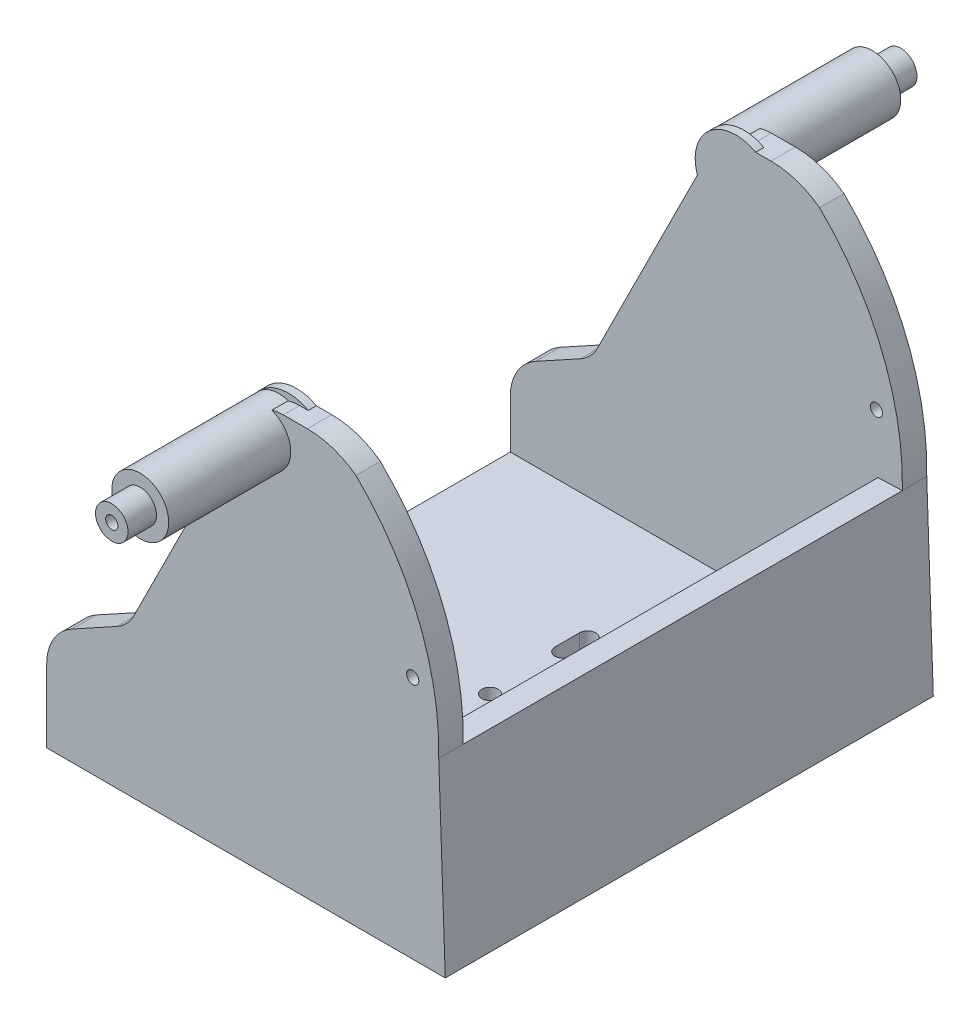
from build123d import *

# Parameters (mm, degrees)
ESQUISSE1_R                  = 0.75
BOSS_EXTRU_1_DEPTH           = 60
BOSS_EXTRU_2_DEPTH           = 15
BOSS_EXTRU_2_DEPTH_BACK      = 75
ESQUISSE3_R                  = 3.5
BOSS_EXTRU_6_DEPTH           = 3.5
BOSS_EXTRU_6_DEPTH_BACK      = 93.5
ESQUISSE9_R                  = 2
ENL_V_MAT_EXTRU_1_DEPTH      = 60
ENL_V_MAT_EXTRU_1_DEPTH_BACK = 60
ESQUISSE2_W                  = 54
ESQUISSE2_H                  = 49.893339448
COQUE1_START                 = 3
COQUE1_DEPTH                 = 54
ESQUISSE4_R                  = 5
BOSS_EXTRU_3_DEPTH           = 1
BOSS_EXTRU_4_START           = -1
ESQUISSE5_R                  = 5
BOSS_EXTRU_4_DEPTH           = 1
ESQUISSE6_R                  = 1
ESQUISSE6_R_2                = 1.75
ENL_V_MAT_EXTRU_2_DEPTH      = 106.483850595
ESQUISSE7_R                  = 4.25
BOSS_EXTRU_5_DEPTH           = 3
ESQUISSE8_R                  = 3
ENL_V_MAT_EXTRU_3_DEPTH      = 3.5
ESQUISSE10_R                 = 0.75
ENL_V_MAT_EXTRU_4_DEPTH      = 5
ENL_V_START                  = -5
ESQUISSE11_R                 = 0.75
ENL_V_MAT_EXTRU_5_DEPTH      = 5


# Read off the part's stored shape, not the designer's step: Coque1
with BuildPart() as part:
    # Esquisse1 → Boss.-Extru.1 (new body)
    with BuildSketch(Plane.XY):
        with BuildLine():
            Line((-45.891512499, 14.209668126), (-40.36556748, 17.248937886))
            ThreePointArc((-40.36556748, 17.248937886), (-39.171022, 18.164446709), (-38.303025274, 19.393949452))
            Line((-38.303025274, 19.393949452), (-24.381966011, 47.236067977))
            ThreePointArc((-24.381966011, 47.236067977), (-22.538485617, 49.253254042), (-19.909830056, 50))
            Line((-19.909830056, 50), (-16.951810307, 50))
            ThreePointArc((-16.951810307, 50), (-13.80448206, 49.491803038), (-10.977046344, 48.018864982))
            ThreePointArc((-10.977046344, 48.018864982), (-3.299292911, 36.562983614), (-0.803177698, 23))
            Line((-0.803177698, 23), (0, 0))
            Line((0, 0), (-49, 0))
            Line((-49, 0), (-49, 8.952372674))
            ThreePointArc((-49, 8.952372674), (-48.164739828, 12.006134698), (-45.891512499, 14.209668126))
        make_face()
        with Locations((-4, 30)):
            Circle(ESQUISSE1_R, mode=Mode.SUBTRACT)
    extrude(amount=BOSS_EXTRU_1_DEPTH)

    # Esquisse3 → Boss.-Extru.2 (add, two sides: drawn at the far end of the back side and taken through both)
    with BuildSketch(Plane(origin=(0, 0, 0), x_dir=(-1, 0, 0), z_dir=(0, 0, -1)).offset(-BOSS_EXTRU_2_DEPTH_BACK)):
        with Locations((22.5, 46.5)):
            Circle(ESQUISSE3_R)
    extrude(amount=BOSS_EXTRU_2_DEPTH + BOSS_EXTRU_2_DEPTH_BACK)

    # Esquisse9 → Boss.-Extru.6 (add, two sides: drawn at the far end of the back side and taken through both)
    with BuildSketch(Plane.XY.offset(75).offset(-BOSS_EXTRU_6_DEPTH_BACK)):
        with Locations((-22.5, 46.5)):
            Circle(ESQUISSE9_R)
    extrude(amount=BOSS_EXTRU_6_DEPTH + BOSS_EXTRU_6_DEPTH_BACK)

    # Esquisse2 → Enlèv. mat.-Extru.1 (cut, two sides: drawn at the far end of the back side and taken through both)
    with BuildSketch(Plane(origin=(0, 0, 0), x_dir=(0, 0, -1), z_dir=(0.999390827019096, 0.034899496702497666, 0)).offset(-ENL_V_MAT_EXTRU_1_DEPTH_BACK)):
        with Locations((-30, 47.946669724)):
            Rectangle(ESQUISSE2_W, ESQUISSE2_H)
    extrude(amount=ENL_V_MAT_EXTRU_1_DEPTH + ENL_V_MAT_EXTRU_1_DEPTH_BACK, mode=Mode.SUBTRACT)

    # Coque1 outline → Coque1 (cut)
    with BuildSketch(Plane.XY.offset(COQUE1_START)):
        with BuildLine():
            Line((-3.106590941, 3), (-3.800860905, 22.881290531))
            Line((-3.800860905, 22.881290531), (-37.141495034, 21.717009932))
            Line((-37.141495034, 21.717009932), (-38.303025274, 19.393949452))
            ThreePointArc((-38.303025274, 19.393949452), (-39.171022, 18.164446709), (-40.36556748, 17.248937886))
            Line((-40.36556748, 17.248937886), (-45.891512499, 14.209668126))
            ThreePointArc((-45.891512499, 14.209668126), (-48.164739828, 12.006134698), (-49, 8.952372674))
            Line((-49, 8.952372674), (-49, 3))
            Line((-49, 3), (-3.106590941, 3))
        make_face()
    extrude(amount=COQUE1_DEPTH, mode=Mode.SUBTRACT)

    # Esquisse4 → Boss.-Extru.3 (add)
    with BuildSketch(Plane.XY.offset(3)):
        with Locations((-21.27670063, 45.631933959)):
            Circle(ESQUISSE4_R)
    extrude(amount=-BOSS_EXTRU_3_DEPTH)

    # Esquisse5 → Boss.-Extru.4 (add)
    with BuildSketch(Plane(origin=(0, 0, 57), x_dir=(-1, 0, 0), z_dir=(0, 0, -1)).offset(BOSS_EXTRU_4_START)):
        with Locations((21.27670063, 45.631933959)):
            Circle(ESQUISSE5_R)
    extrude(amount=BOSS_EXTRU_4_DEPTH)

    # Esquisse6 → Enlèv. mat.-Extru.2 (cut, through all)
    with BuildSketch(Plane.XZ):
        with Locations((-24.5, 30)):
            Circle(ESQUISSE6_R)
        with Locations((-15, 40)):
            Circle(ESQUISSE6_R_2)
        with BuildLine():
            Line((-12.5, 29), (-15.5, 29))
            ThreePointArc((-15.5, 29), (-16.5, 30), (-15.5, 31))
            Line((-15.5, 31), (-12.5, 31))
            ThreePointArc((-12.5, 31), (-11.5, 30), (-12.5, 29))
        make_face()
        with BuildLine():
            Line((-25.5, 18), (-25.5, 21))
            ThreePointArc((-25.5, 21), (-24.5, 22), (-23.5, 21))
            Line((-23.5, 21), (-23.5, 18))
            ThreePointArc((-23.5, 18), (-24.5, 17), (-25.5, 18))
        make_face()
        with BuildLine():
            Line((-36.5, 31), (-33.5, 31))
            ThreePointArc((-33.5, 31), (-32.5, 30), (-33.5, 29))
            Line((-33.5, 29), (-36.5, 29))
            ThreePointArc((-36.5, 29), (-37.5, 30), (-36.5, 31))
        make_face()
        with BuildLine():
            Line((-23.5, 42), (-23.5, 39))
            ThreePointArc((-23.5, 39), (-24.5, 38), (-25.5, 39))
            Line((-25.5, 39), (-25.5, 42))
            ThreePointArc((-25.5, 42), (-24.5, 43), (-23.5, 42))
        make_face()
    extrude(amount=-ENL_V_MAT_EXTRU_2_DEPTH, mode=Mode.SUBTRACT)

    # Esquisse7 → Boss.-Extru.5 (add)
    with BuildSketch(Plane.XZ):
        with Locations(Location((-24.5, 30, 0), (0, 0, 180))):
            Circle(ESQUISSE7_R)
    extrude(amount=BOSS_EXTRU_5_DEPTH)

    # Esquisse8 → Enlèv. mat.-Extru.3 (cut)
    with BuildSketch(Plane.XZ.offset(3)):
        with Locations((-24.5, 30)):
            Circle(ESQUISSE8_R)
    extrude(amount=-ENL_V_MAT_EXTRU_3_DEPTH, mode=Mode.SUBTRACT)

    # Esquisse10 → Enlèv. mat.-Extru.4 (cut)
    with BuildSketch(Plane.XY.offset(78.5)):
        with Locations((-22.5, 46.5)):
            Circle(ESQUISSE10_R)
    extrude(amount=-ENL_V_MAT_EXTRU_4_DEPTH, mode=Mode.SUBTRACT)

    # Esquisse11 → Enlèv. mat.-Extru.5 (cut)
    with BuildSketch(Plane(origin=(0, 0, -18.5), x_dir=(-1, 0, 0), z_dir=(0, 0, -1)).offset(ENL_V_START)):
        with Locations(Location((22.5, 46.5, 0), (0, 0, 180))):
            Circle(ESQUISSE11_R)
    extrude(amount=ENL_V_MAT_EXTRU_5_DEPTH, mode=Mode.SUBTRACT)


solid = part.part
